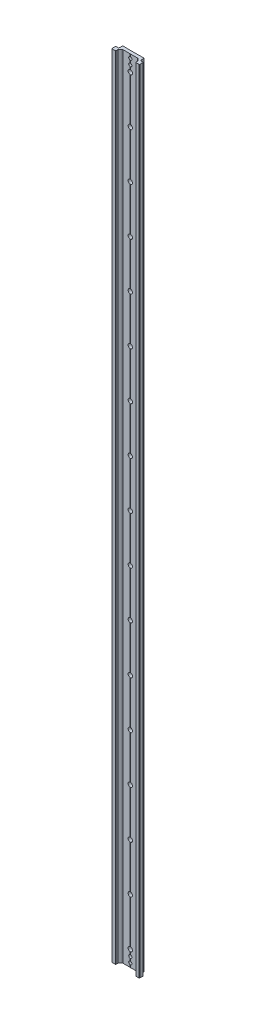
from build123d import *

# Parameters (mm, degrees)
BOSS_EXTRU_1_DEPTH                  = 1000
DIAM_TRE_DU_PER_AGE_5_5_5_5_1_D     = 5.5
DIAM_TRE_DU_PER_AGE_5_5_5_5_1_DEPTH = 9.900000185
ESQUISSE5_R                         = 2
ENL_V_MAT_EXTRU_1_DEPTH             = 10


with BuildPart() as part:
    # Esquisse1 → Boss.-Extru.1 (new body)
    with BuildSketch(Plane(origin=(0, 500, 0), x_dir=(1, 0, 0), z_dir=(0, 1, 0))):
        with BuildLine():
            Line((-7.40002072, 4.900000175), (-7.50002072, 5.000000175))
            Line((-7.50002072, 5.000000175), (-13.20002072, 5.000000175))
            Line((-13.20002072, 5.000000175), (-13.50002072, 4.700000175))
            Line((-13.50002072, 4.700000175), (-13.50002072, 1.628427117))
            ThreePointArc((-13.50002072, 1.628427117), (-13.652261651, 0.863060273), (-14.085807141, 0.214213594))
            Line((-14.085807141, 0.214213594), (-14.30002069, 4.5e-08))
            Line((-14.30002069, 4.5e-08), (-17.00002072, 4.5e-08))
            Line((-17.00002072, 4.5e-08), (-17.50002072, -0.499999925))
            Line((-17.50002072, -0.499999925), (-17.50002072, -4.499999925))
            Line((-17.50002072, -4.499999925), (-17.000020665, -5.00000001))
            Line((-17.000020665, -5.00000001), (-13.00002072, -5.00000001))
            Line((-13.00002072, -5.00000001), (-12.500020741, -4.500000019))
            Line((-12.500020741, -4.500000019), (-12.500020741, -1.800000019))
            Line((-12.500020741, -1.800000019), (-10.139360364, 0.560660358))
            ThreePointArc((-10.139360364, 0.560660358), (-9.652725352, 0.885819477), (-9.078700218, 1.000000175))
            Line((-9.078700218, 1.000000175), (-0.25, 1.000000175))
            Line((-0.25, 1.000000175), (1e-09, 1.144337743))
            Line((1e-09, 1.144337743), (0.25, 1.000000175))
            Line((0.25, 1.000000175), (9.078700232, 1.000000175))
            ThreePointArc((9.078700232, 1.000000175), (9.652725366, 0.885819477), (10.139360377, 0.560660358))
            Line((10.139360377, 0.560660358), (12.500020747, -1.800000013))
            Line((12.500020747, -1.800000013), (12.500020747, -4.500000013))
            Line((12.500020747, -4.500000013), (13.00002072, -5.00000001))
            Line((13.00002072, -5.00000001), (17.00002072, -5.00000001))
            Line((17.00002072, -5.00000001), (17.500020747, -4.500000008))
            Line((17.500020747, -4.500000008), (17.500020747, -0.500000007))
            Line((17.500020747, -0.500000007), (17.00002075, 4.5e-08))
            Line((17.00002075, 4.5e-08), (14.30002072, 4.5e-08))
            Line((14.30002072, 4.5e-08), (14.085807141, 0.214213624))
            ThreePointArc((14.085807141, 0.214213624), (13.652261651, 0.863060303), (13.50002072, 1.628427147))
            Line((13.50002072, 1.628427147), (13.50002072, 4.700000175))
            Line((13.50002072, 4.700000175), (13.20002072, 5.000000175))
            Line((13.20002072, 5.000000175), (7.50002072, 5.000000175))
            Line((7.50002072, 5.000000175), (7.40002072, 4.900000175))
            Line((7.40002072, 4.900000175), (-7.40002072, 4.900000175))
        make_face()
    extrude(amount=-BOSS_EXTRU_1_DEPTH)

    # Diamètre du perçage Ø5.5 (5.5)1
    with Locations(Plane(origin=(0, 0, -4.900000175), x_dir=(-1, 0, 0), z_dir=(0, 0, -1))):
        with Locations((0, 420), (0, 480), (0, -480), (0, -420), (0, -360), (0, -300), (0, -240), (0, -180), (0, -120), (0, -60), (0, 0), (0, 60), (0, 120), (0, 180), (0, 240), (0, 300), (0, 360)):
            Hole(DIAM_TRE_DU_PER_AGE_5_5_5_5_1_D / 2, depth=DIAM_TRE_DU_PER_AGE_5_5_5_5_1_DEPTH)

    # Esquisse5 → Enlèv. mat.-Extru.1 (cut)
    with BuildSketch(Plane(origin=(0, 0, -4.900000175), x_dir=(-1, 0, 0), z_dir=(0, 0, -1))):
        with Locations((0, -495)):
            Circle(ESQUISSE5_R)
        with Locations((0, -488)):
            Circle(ESQUISSE5_R)
        with Locations((0, 488)):
            Circle(ESQUISSE5_R)
        with Locations((0, 495)):
            Circle(ESQUISSE5_R)
    extrude(amount=-ENL_V_MAT_EXTRU_1_DEPTH, mode=Mode.SUBTRACT)


solid = part.part
